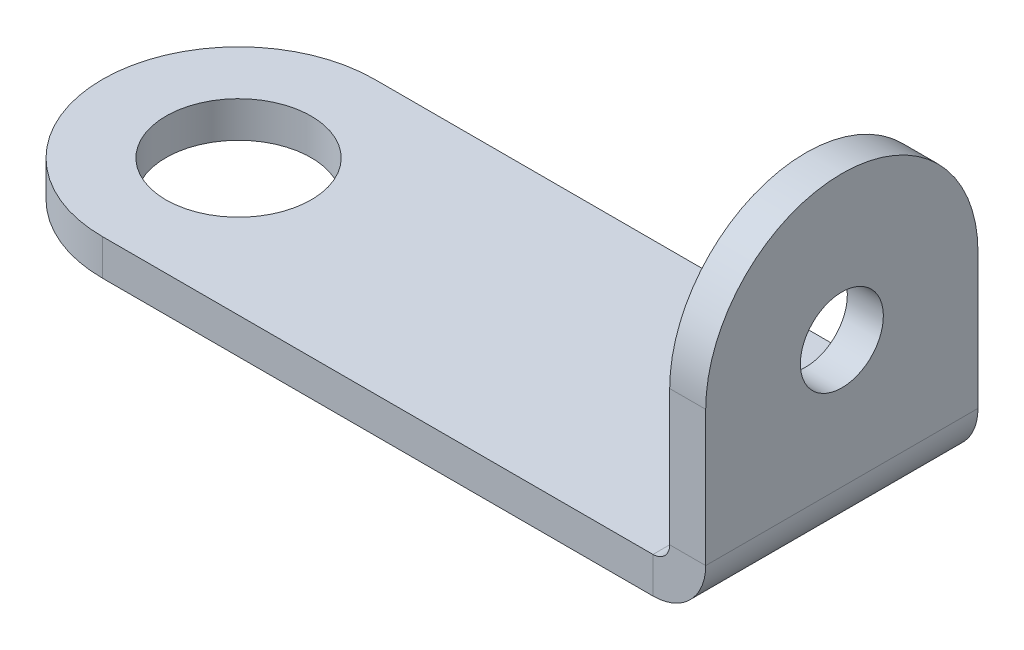
from build123d import *

# Parameters (mm, degrees)
SKETCH1_R                    = 3.2
BASE_FLANGE1_DEPTH           = 1.5875
EDGE_FLANGE1_STRIP_W         = 7.8232
EDGE_FLANGE1_STRIP_H         = 1.5875
EDGE_FLANGE1_STRIP_CUT_DEPTH = 12
EDGE_FLANGE1_DEPTH           = 12
HOLE1_START                  = 25
HOLE1_OUTLINE_R              = 1.8288
HOLE1_DEPTH                  = 1.5875
FILLET1_RADIUS               = 6
FILLET1_LENGTH               = 1.5875


# Read off the part's stored shape, not the designer's step: Hole1
# Sheet-metal steps are written as plain solids
with BuildPart() as part:
    # Sketch1 → Base-Flange1 (new body)
    with BuildSketch(Plane(origin=(0, 0, 0), x_dir=(1, 0, 0), z_dir=(0, 1, 0))):
        with BuildLine():
            Line((0, 6), (25, 6))
            Line((25, 6), (25, -6))
            Line((25, -6), (0, -6))
            ThreePointArc((0, -6), (-6, 0), (0, 6))
        make_face()
        with Locations(Location((0, 0, 0), (0, 0, 270))):
            Circle(SKETCH1_R, mode=Mode.SUBTRACT)
    extrude(amount=BASE_FLANGE1_DEPTH)

    # Edge-Flange1 strip (across the edge) → Edge-Flange1 strip cut (cut)
    with BuildSketch(Plane(origin=(25, 1.5875, 6), x_dir=(-1, 0, 0), z_dir=(0, 0, -1))):
        with Locations((-3.175, -0.79375)):
            Rectangle(EDGE_FLANGE1_STRIP_W, EDGE_FLANGE1_STRIP_H)
    extrude(amount=EDGE_FLANGE1_STRIP_CUT_DEPTH, mode=Mode.SUBTRACT)

    # Edge-Flange1 section (across the edge) → Edge-Flange1 (add)
    with BuildSketch(Plane(origin=(25, 1.5875, 6), x_dir=(-1, 0, 0), z_dir=(0, 0, -1))):
        with BuildLine():
            Line((-1.5875, 0.7366), (-1.5875, 12.7))
            Line((-1.5875, 12.7), (0, 12.7))
            Line((0, 12.7), (0, 0.7366))
            ThreePointArc((0, 0.7366), (0.215745145, 0.215745145), (0.7366, 0))
            Line((0.7366, 0), (0.7366, -1.5875))
            ThreePointArc((0.7366, -1.5875), (-0.90678687, -0.90678687), (-1.5875, 0.7366))
        make_face()
    extrude(amount=EDGE_FLANGE1_DEPTH)

    # Hole1 outline → Hole1 (cut)
    with BuildSketch(Plane.YZ.offset(HOLE1_START)):
        with Locations((7.9375, 0)):
            Circle(HOLE1_OUTLINE_R)
    extrude(amount=HOLE1_DEPTH, mode=Mode.SUBTRACT)

    # Fillet1: full round fillet: the end face becomes a half cylinder, R = half its width
    fillet1_face = Plane((25.79375, 14.2875, 0), x_dir=(1, 0, 0), z_dir=(0, 1, 0))  # on the end face: x along it, z out of the body
    fillet1_slab = fillet1_face.offset(-FILLET1_RADIUS / 2) * Box(FILLET1_LENGTH, 2 * FILLET1_RADIUS, FILLET1_RADIUS, mode=Mode.PRIVATE)  # the body's end, R deep
    fillet1_round = Plane((25.79375, 8.2875, 0), x_dir=(0, 1, 0), z_dir=(1, 0, 0)) * Cylinder(FILLET1_RADIUS, FILLET1_LENGTH, mode=Mode.PRIVATE)  # its axis R under the face
    add(fillet1_slab - fillet1_round, mode=Mode.SUBTRACT)


solid = part.part
